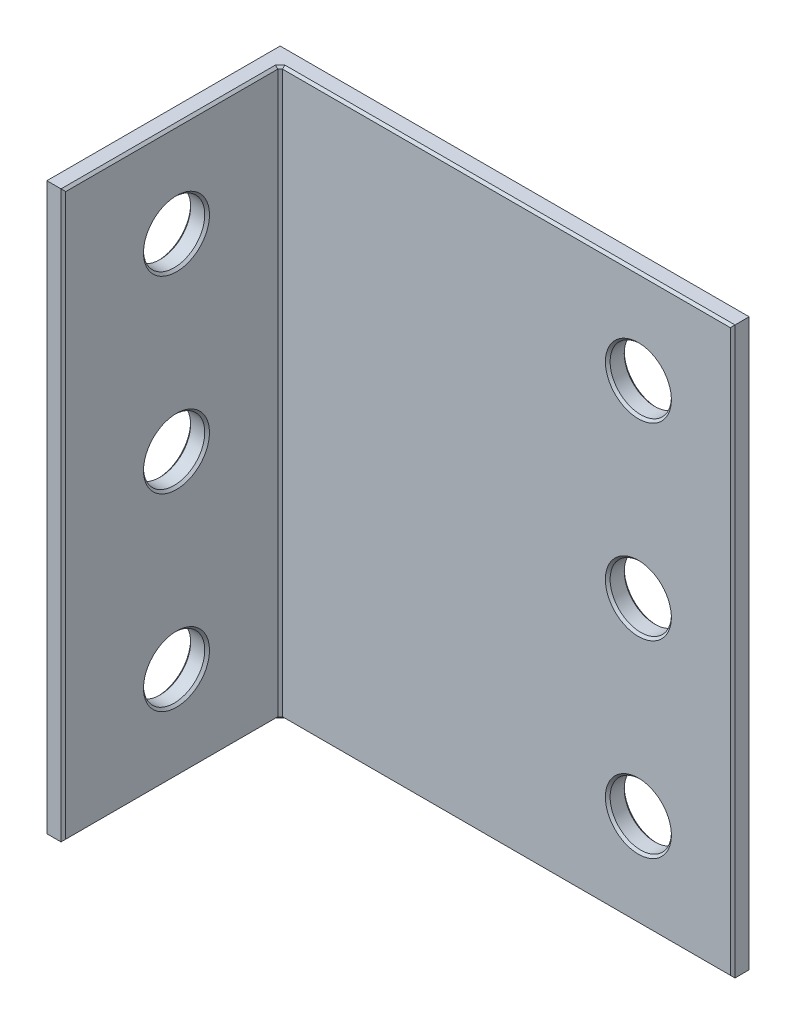
from build123d import *

# Parameters (mm, degrees)
SKETCH_1_W          = 200
SKETCH_1_H          = 240
SKETCH_1_R          = 13
EXTRUDE_328_DEPTH   = 8
SKETCH_2_W          = 8
SKETCH_2_H          = 240
EXTRUDE_1_DEPTH     = 92
SKETCH_3_R          = 13
CUT_EXTRUDE_1_DEPTH = 329.024389337
CHAMFER_1_SIZE      = 1


with BuildPart() as part:
    # 草图1 → Extrude 328 (new body)
    with BuildSketch(Plane.XY):
        with Locations((100, 120)):
            Rectangle(SKETCH_1_W, SKETCH_1_H)
        with Locations((160, 40)):
            Circle(SKETCH_1_R, mode=Mode.SUBTRACT)
        with Locations((160, 120)):
            Circle(SKETCH_1_R, mode=Mode.SUBTRACT)
        with Locations((160, 200)):
            Circle(SKETCH_1_R, mode=Mode.SUBTRACT)
    extrude(amount=EXTRUDE_328_DEPTH)

    # 草图2 → 凸台-拉伸1 (add)
    with BuildSketch(Plane.XY.offset(8)):
        with Locations((4, 120)):
            Rectangle(SKETCH_2_W, SKETCH_2_H)
    extrude(amount=EXTRUDE_1_DEPTH)

    # 草图3 → 切除-拉伸1 (cut, through all)
    with BuildSketch(Plane.ZY):
        with Locations((52, 200)):
            Circle(SKETCH_3_R)
        with Locations((52, 120)):
            Circle(SKETCH_3_R)
        with Locations((52, 40)):
            Circle(SKETCH_3_R)
    extrude(amount=-CUT_EXTRUDE_1_DEPTH, mode=Mode.SUBTRACT)

    # 倒角1
    chamfer_1_edges = [part.edges().sort_by_distance(p)[0] for p in [
        (147, 200, 0),
        (147, 40, 0),
        (147, 120, 0),
        (147, 120, 8),
        (147, 40, 8),
        (147, 200, 8),
        (100, 0, 0),
        (200, 120, 0),
        (100, 240, 0),
        (0, 240, 50),
        (0, 120, 100),
        (0, 0, 50),
        (0, 120, 0),
        (0, 200, 39),
        (0, 120, 39),
        (0, 40, 39),
        (104, 240, 8),
        (200, 120, 8),
        (104, 0, 8),
        (8, 0, 54),
        (8, 120, 100),
        (8, 240, 54),
        (8, 120, 8),
        (8, 200, 39),
        (8, 120, 39),
        (8, 40, 39),
    ]]
    chamfer(chamfer_1_edges, length=CHAMFER_1_SIZE)


solid = part.part
